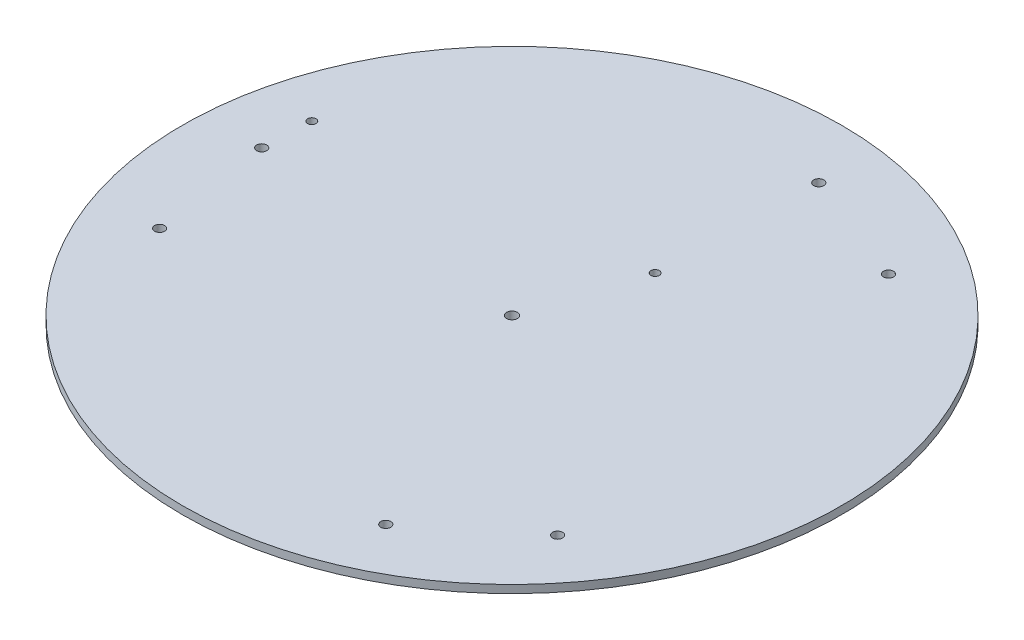
from build123d import *

# Parameters (mm, degrees)
SKETCH2_R               = 125
BOSS_EXTRUDE1_DEPTH     = 3
CUT_EXTRUDE1_DEPTH      = 62
CUT_EXTRUDE1_DEPTH_BACK = 26
SKETCH3_R               = 1.905
CUT_EXTRUDE2_DEPTH      = 55
CUT_EXTRUDE2_DEPTH_BACK = 33
SKETCH4_R               = 2.05
SKETCH5_R               = 1.6
CUT_EXTRUDE3_DEPTH      = 177.802149308


with BuildPart() as part:
    # Sketch2 → Boss-Extrude1 (new body)
    with BuildSketch(Plane(origin=(0, 0, 0), x_dir=(1, 0, 0), z_dir=(0, 1, 0))):
        Circle(SKETCH2_R)
    extrude(amount=BOSS_EXTRUDE1_DEPTH)

    # Sketch3 → Cut-Extrude1 (cut, two sides: drawn at the far end of the back side and taken through both)
    with BuildSketch(Plane(origin=(0, 3, 0), x_dir=(1, 0, 0), z_dir=(0, 1, 0)).offset(-CUT_EXTRUDE1_DEPTH_BACK)):
        with Locations((57.824361976, 84.994428132)):
            Circle(SKETCH3_R)
        with Locations((14.606066285, 101.75643704)):
            Circle(SKETCH3_R)
        with Locations((44.695152955, -92.574580495)):
            Circle(SKETCH3_R)
        with Locations((80.820626333, -63.527442972)):
            Circle(SKETCH3_R)
        with Locations((-102.519514931, 7.580152362)):
            Circle(SKETCH3_R)
        with Locations((-95.426692618, -38.228994068)):
            Circle(SKETCH3_R)
    extrude(amount=CUT_EXTRUDE1_DEPTH + CUT_EXTRUDE1_DEPTH_BACK, mode=Mode.SUBTRACT)

    # Sketch4 → Cut-Extrude2 (cut, two sides: drawn at the far end of the back side and taken through both)
    with BuildSketch(Plane(origin=(0, 3, 0), x_dir=(1, 0, 0), z_dir=(0, 1, 0)).offset(-CUT_EXTRUDE2_DEPTH_BACK)):
        Circle(SKETCH4_R)
    extrude(amount=CUT_EXTRUDE2_DEPTH + CUT_EXTRUDE2_DEPTH_BACK, mode=Mode.SUBTRACT)

    # Sketch5 → Cut-Extrude3 (cut, through all)
    with BuildSketch(Plane.XZ):
        with Locations((-101.778099897, -25.854755487)):
            Circle(SKETCH5_R)
        with Locations((13.216774043, -41.092175458)):
            Circle(SKETCH5_R)
    extrude(amount=-CUT_EXTRUDE3_DEPTH, mode=Mode.SUBTRACT)


solid = part.part
